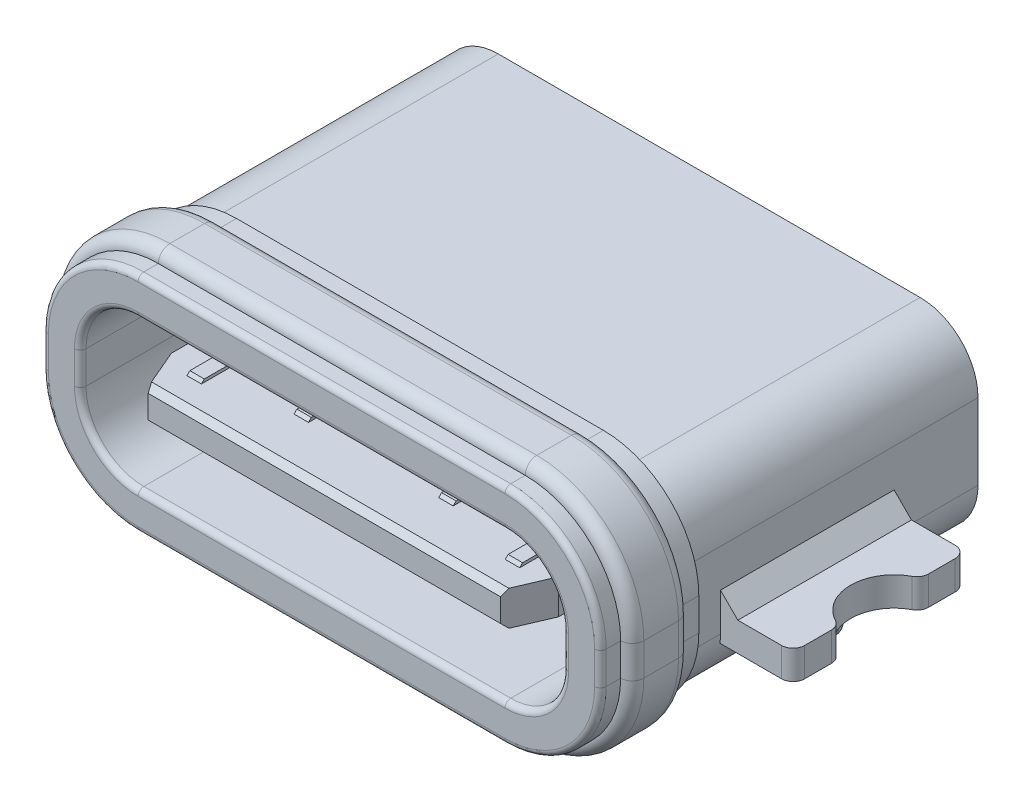
from build123d import *

# Parameters (mm, degrees)
SKETCH1_W            = 9.29
SKETCH1_H            = 3.31
BOSS_EXTRUDE1_DEPTH  = 5
FILLET1_R            = 1
SKETCH2_W            = 11.8
SKETCH2_H            = 3
BOSS_EXTRUDE2_DEPTH  = 0.5
SKETCH3_R            = 0.75
CUT_EXTRUDE1_DEPTH   = 0.5
FILLET2_R            = 0.2
FILLET15_SIZE        = 0.3
SKETCH4_W            = 10.26886331
SKETCH4_H            = 0.5
BOSS_EXTRUDE3_DEPTH  = 0.5
FILLET4_R            = 0.2
BOSS_EXTRUDE4_DEPTH  = 1.7
BOSS_EXTRUDE7_DEPTH  = 0.5
FILLET12_R           = 0.2
CUT_EXTRUDE4_DEPTH   = 4.5
BOSS_EXTRUDE8_DEPTH  = 0.3
SKETCH20_W           = 6.69
SKETCH20_H           = 1.2
BOSS_EXTRUDE11_DEPTH = 1.62
CHAMFER2_SIZE        = 0.25
FILLET13_R           = 0.4
CHAMFER1_SIZE        = 0.1
SKETCH17_W           = 0.25
SKETCH17_H           = 3.45
SKETCH17_H_2         = 3.65
SKETCH17_H_3         = 4
BOSS_EXTRUDE9_DEPTH  = 0.05
CHAMFER3_SIZE        = 0.1
MIRROR1_START        = 2.625
MIRROR1_DEPTH        = 0.25
MIRROR1_START_2      = 1.125
MIRROR1_2_DEPTH      = 0.25
MIRROR1_START_3      = 0.125
MIRROR1_3_DEPTH      = 0.25
MIRROR1_START_4      = 0.625
MIRROR1_4_DEPTH      = 0.25
MIRROR1_START_5      = 1.625
MIRROR1_5_DEPTH      = 0.25
MIRROR1_START_6      = 2.125
MIRROR1_6_DEPTH      = 0.25
MIRROR2_START        = -2.875
MIRROR2_DEPTH        = 0.25
MIRROR2_START_2      = 2.625
MIRROR2_2_DEPTH      = 0.25
MIRROR2_START_3      = -1.375
MIRROR2_3_DEPTH      = 0.25
MIRROR2_START_4      = 1.125
MIRROR2_4_DEPTH      = 0.25
MIRROR2_START_5      = -2.375
MIRROR2_5_DEPTH      = 0.25
MIRROR2_START_6      = -1.875
MIRROR2_6_DEPTH      = 0.25
MIRROR2_START_7      = -0.875
MIRROR2_7_DEPTH      = 0.25
MIRROR2_START_8      = -0.375
MIRROR2_8_DEPTH      = 0.25
MIRROR2_START_9      = 0.125
MIRROR2_9_DEPTH      = 0.25
MIRROR2_START_10     = 0.625
MIRROR2_10_DEPTH     = 0.25
MIRROR2_START_11     = 1.625
MIRROR2_11_DEPTH     = 0.25
MIRROR2_START_12     = 2.125
MIRROR2_12_DEPTH     = 0.25
FILLET14_R           = 0.1
CUT_EXTRUDE5_DEPTH   = 0.2
BOSS_EXTRUDE12_START = -3
BOSS_EXTRUDE12_DEPTH = 6
SKETCH23_W           = 0.4
SKETCH23_H           = 1.49
CUT_EXTRUDE6_DEPTH   = 1


# Read off the part's stored shape, not the designer's step: Mirror1, Mirror2, Boss-Extrude12
# Some blends are built 0.0001 mm under size
with BuildPart() as part:
    # Sketch1 → Boss-Extrude1 (new body)
    with BuildSketch(Plane.XY):
        with Locations((0, 0.8)):
            Rectangle(SKETCH1_W, SKETCH1_H)
    extrude(amount=BOSS_EXTRUDE1_DEPTH)

    # Fillet1
    fillet1_edges = [part.edges().sort_by_distance(p)[0] for p in [
        (4.645, -0.855, 2.5),
        (-4.645, -0.855, 2.5),
        (-4.645, 2.455, 2.5),
        (4.645, 2.455, 2.5),
    ]]
    fillet(fillet1_edges, radius=FILLET1_R)

    # Sketch2 → Boss-Extrude2 (add)
    with BuildSketch(Plane(origin=(0, 0, 0), x_dir=(1, 0, 0), z_dir=(0, 1, 0))):
        with Locations((0, -2.95)):
            Rectangle(SKETCH2_W, SKETCH2_H)
    extrude(amount=BOSS_EXTRUDE2_DEPTH)

    # Sketch3 → Cut-Extrude1 (cut)
    with BuildSketch(Plane(origin=(0, 0.5, 0), x_dir=(1, 0, 0), z_dir=(0, 1, 0))):
        with Locations((6.145, -2.95)):
            Circle(SKETCH3_R)
        with Locations((-6.145, -2.95)):
            Circle(SKETCH3_R)
    extrude(amount=-CUT_EXTRUDE1_DEPTH, mode=Mode.SUBTRACT)

    # Fillet2
    fillet2_edges = [part.edges().sort_by_distance(p)[0] for p in [
        (-5.9, 0.25, 4.45),
        (5.9, 0.25, 1.45),
        (-5.9, 0.25, 1.45),
        (5.9, 0.25, 4.45),
        (5.9, 0.25, 2.24114529),
        (5.9, 0.25, 3.65885471),
        (-5.9, 0.25, 2.24114529),
        (-5.9, 0.25, 3.65885471),
    ]]
    fillet(fillet2_edges, radius=FILLET2_R)

    # Fillet15
    fillet15_edges = [part.edges().sort_by_distance(p)[0] for p in [
        (-4.645, 0.5, 2.95),
        (4.645, 0.5, 2.95),
    ]]
    chamfer(fillet15_edges, length=FILLET15_SIZE)

    # Sketch4 → Boss-Extrude3 (add)
    with BuildSketch(Plane.XZ):
        with Locations((0, 2.95)):
            Rectangle(SKETCH4_W, SKETCH4_H)
    extrude(amount=BOSS_EXTRUDE3_DEPTH)

    # Fillet4
    fillet4_edges = [part.edges().sort_by_distance(p)[0] for p in [
        (4.771807112, -0.5, 2.7),
        (5.134431655, -0.5, 2.95),
        (4.771807112, -0.5, 3.2),
        (5.134431655, -0.25, 3.2),
        (5.134431655, -0.25, 2.7),
        (-5.134431655, -0.25, 3.2),
        (-5.134431655, -0.25, 2.7),
        (-4.771807112, -0.5, 3.2),
        (-5.134431655, -0.5, 2.95),
        (-4.771807112, -0.5, 2.7),
    ]]
    fillet(fillet4_edges, radius=FILLET4_R)

    # Sketch5 → Boss-Extrude4 (add)
    with BuildSketch(Plane.XY.offset(5)):
        with BuildLine():
            Line((-4.82, 1.08), (-4.82, 0.52))
            ThreePointArc((-4.82, 0.52), (-4.336726189, -0.646726189), (-3.17, -1.13))
            Line((-3.17, -1.13), (3.17, -1.13))
            ThreePointArc((3.17, -1.13), (4.336726189, -0.646726189), (4.82, 0.52))
            Line((4.82, 0.52), (4.82, 1.08))
            ThreePointArc((4.82, 1.08), (4.336726189, 2.246726189), (3.17, 2.73))
            Line((3.17, 2.73), (-3.17, 2.73))
            ThreePointArc((-3.17, 2.73), (-4.336726189, 2.246726189), (-4.82, 1.08))
        make_face()
    extrude(amount=BOSS_EXTRUDE4_DEPTH)

    # Sketch11 → Boss-Extrude7 (add, symmetric)
    with BuildSketch(Plane.XY.offset(5.85)):
        with BuildLine():
            Line((-5.02, 1.08), (-5.02, 0.52))
            ThreePointArc((-5.02, 0.52), (-4.478147545, -0.788147545), (-3.17, -1.33))
            Line((-3.17, -1.33), (3.17, -1.33))
            ThreePointArc((3.17, -1.33), (4.478147545, -0.788147545), (5.02, 0.52))
            Line((5.02, 0.52), (5.02, 1.08))
            ThreePointArc((5.02, 1.08), (4.478147545, 2.388147545), (3.17, 2.93))
            Line((3.17, 2.93), (-3.17, 2.93))
            ThreePointArc((-3.17, 2.93), (-4.478147545, 2.388147545), (-5.02, 1.08))
        make_face()
    extrude(amount=BOSS_EXTRUDE7_DEPTH, both=True)

    # Fillet12
    fillet12_edges = [part.edges().sort_by_distance(p)[0] for p in [
        (-4.478147545, 2.388147545, 6.35),
        (-5.02, 0.8, 6.35),
        (-4.478147545, -0.788147545, 6.35),
        (0, -1.33, 6.35),
        (4.478147545, -0.788147545, 6.35),
        (5.02, 0.8, 6.35),
        (4.478147545, 2.388147545, 6.35),
        (0, 2.93, 6.35),
        (-4.478147545, 2.388147545, 5.35),
        (-5.02, 0.8, 5.35),
        (-4.478147545, -0.788147545, 5.35),
        (0, -1.33, 5.35),
        (4.478147545, -0.788147545, 5.35),
        (5.02, 0.8, 5.35),
        (4.478147545, 2.388147545, 5.35),
        (0, 2.93, 5.35),
    ]]
    fillet(fillet12_edges, radius=FILLET12_R - 0.0001)  # a hair under: the kernel refuses the full size

    # Sketch14 → Cut-Extrude4 (cut)
    with BuildSketch(Plane.XY.offset(6.7)):
        with BuildLine():
            Line((-3.17, 2.08), (3.17, 2.08))
            ThreePointArc((3.17, 2.08), (3.877106781, 1.787106781), (4.17, 1.08))
            Line((4.17, 1.08), (4.17, 0.52))
            ThreePointArc((4.17, 0.52), (3.877106781, -0.187106781), (3.17, -0.48))
            Line((3.17, -0.48), (-3.17, -0.48))
            ThreePointArc((-3.17, -0.48), (-3.877106781, -0.187106781), (-4.17, 0.52))
            Line((-4.17, 0.52), (-4.17, 1.08))
            ThreePointArc((-4.17, 1.08), (-3.877106781, 1.787106781), (-3.17, 2.08))
        make_face()
    extrude(amount=-CUT_EXTRUDE4_DEPTH, mode=Mode.SUBTRACT)

    # Sketch16 → Boss-Extrude8 (add, symmetric)
    with BuildSketch(Plane(origin=(0, 0.8, 0), x_dir=(1, 0, 0), z_dir=(0, 1, 0))):
        with BuildLine():
            Line((-3.345, -2.2), (-3.345, -3.9))
            ThreePointArc((-3.345, -3.9), (-3.165871215, -4.002154822), (-3.095, -4.195803989))
            Line((-3.095, -4.195803989), (-3.095, -5.104196011))
            ThreePointArc((-3.095, -5.104196011), (-3.165871215, -5.297845178), (-3.345, -5.4))
            Line((-3.345, -5.4), (-3.345, -5.95))
            Line((-3.345, -5.95), (-3.045, -6.65))
            Line((-3.045, -6.65), (3.045, -6.65))
            Line((3.045, -6.65), (3.345, -5.95))
            Line((3.345, -5.95), (3.345, -5.4))
            ThreePointArc((3.345, -5.4), (3.165871215, -5.297845178), (3.095, -5.104196011))
            Line((3.095, -5.104196011), (3.095, -4.195803989))
            ThreePointArc((3.095, -4.195803989), (3.165871215, -4.002154822), (3.345, -3.9))
            Line((3.345, -3.9), (3.345, -2.2))
            Line((3.345, -2.2), (-3.345, -2.2))
        make_face()
    extrude(amount=BOSS_EXTRUDE8_DEPTH, both=True)

    # Sketch20 → Boss-Extrude11 (add)
    with BuildSketch(Plane.XY.offset(2.2)):
        with Locations((0, 0.8)):
            Rectangle(SKETCH20_W, SKETCH20_H)
    extrude(amount=BOSS_EXTRUDE11_DEPTH)

    # Chamfer2
    chamfer2_edges = [part.edges().sort_by_distance(p)[0] for p in [
        (0, 0.2, 3.82),
        (0, 1.4, 3.82),
    ]]
    chamfer(chamfer2_edges, length=CHAMFER2_SIZE)

    # Fillet13
    fillet13_edges = [part.edges().sort_by_distance(p)[0] for p in [
        (3.345, 0.2, 2.885),
        (3.345, 1.4, 2.885),
        (-3.345, 0.2, 2.885),
        (-3.345, 1.4, 2.885),
    ]]
    fillet(fillet13_edges, radius=FILLET13_R)

    # Chamfer1
    chamfer1_edges = [part.edges().sort_by_distance(p)[0] for p in [
        (0, 0.5, 6.65),
        (0, 1.1, 6.65),
    ]]
    chamfer(chamfer1_edges, length=CHAMFER1_SIZE)

    # Sketch17 → Boss-Extrude9 (add, symmetric)
    with BuildSketch(Plane(origin=(0, 1.1, 0), x_dir=(1, 0, 0), z_dir=(0, 1, 0))):
        with Locations((-0.25, -3.925)):
            Rectangle(SKETCH17_W, SKETCH17_H)
        with Locations((-0.75, -3.925)):
            Rectangle(SKETCH17_W, SKETCH17_H)
        with Locations((-1.25, -4.025)):
            Rectangle(SKETCH17_W, SKETCH17_H_2)
        with Locations((-1.75, -3.925)):
            Rectangle(SKETCH17_W, SKETCH17_H)
        with Locations((-2.25, -3.925)):
            Rectangle(SKETCH17_W, SKETCH17_H)
        with Locations((-2.75, -4.2)):
            Rectangle(SKETCH17_W, SKETCH17_H_3)
    extrude(amount=BOSS_EXTRUDE9_DEPTH, both=True)

    # Chamfer3
    # the kernel refuses this chamfer: 0.1 mm, written as the material it takes off along each edge
    with BuildSketch(Plane(origin=(-0.367831701, 1.15, 5.65), x_dir=(0, -0.9996219169112966, 0.027495876610587302), z_dir=(-1, 0, 0))) as chamfer3_piece_1_section:
        Polygon((CHAMFER3_SIZE * 0.999621916911, -CHAMFER3_SIZE * 0.0274958766106), (-CHAMFER3_SIZE * 0.0274958766106, -CHAMFER3_SIZE * 0.999621916911), (0, 0), align=None)
    chamfer3_piece_1 = extrude(amount=0.507168299, mode=Mode.PRIVATE)
    chamfer3_piece_1 = split(chamfer3_piece_1, bisect_by=Plane(origin=(-0.371415851, 1.1, 5.611111111), z_dir=(0, 1, 0)), keep=Keep.TOP, mode=Mode.PRIVATE)
    add(chamfer3_piece_1, mode=Mode.SUBTRACT)
    with BuildSketch(Plane(origin=(-0.867831701, 1.15, 5.85), x_dir=(0, -0.9996219169112966, 0.027495876610587302), z_dir=(-1, 0, 0))) as chamfer3_piece_2_section:
        Polygon((CHAMFER3_SIZE * 0.999621916911, -CHAMFER3_SIZE * 0.0274958766106), (-CHAMFER3_SIZE * 0.0274958766106, -CHAMFER3_SIZE * 0.999621916911), (0, 0), align=None)
    chamfer3_piece_2 = extrude(amount=0.764336598, mode=Mode.PRIVATE)
    chamfer3_piece_2 = split(chamfer3_piece_2, bisect_by=Plane(origin=(-1.25, 1.1, 5.811111111), z_dir=(0, 1, 0)), keep=Keep.TOP, mode=Mode.PRIVATE)
    add(chamfer3_piece_2, mode=Mode.SUBTRACT)
    with BuildSketch(Plane(origin=(-1.367831701, 1.15, 5.65), x_dir=(0, -0.9996219169112966, 0.027495876610587302), z_dir=(-1, 0, 0))) as chamfer3_piece_3_section:
        Polygon((CHAMFER3_SIZE * 0.999621916911, -CHAMFER3_SIZE * 0.0274958766106), (-CHAMFER3_SIZE * 0.0274958766106, -CHAMFER3_SIZE * 0.999621916911), (0, 0), align=None)
    chamfer3_piece_3 = extrude(amount=0.764336598, mode=Mode.PRIVATE)
    chamfer3_piece_3 = split(chamfer3_piece_3, bisect_by=Plane(origin=(-1.75, 1.1, 5.611111111), z_dir=(0, 1, 0)), keep=Keep.TOP, mode=Mode.PRIVATE)
    chamfer3_piece_3 = split(chamfer3_piece_3, bisect_by=Plane(origin=(-1.375, 1.127777778, 5.611111111), z_dir=(-1, 0, 0)), keep=Keep.TOP, mode=Mode.PRIVATE)
    add(chamfer3_piece_3, mode=Mode.SUBTRACT)
    with BuildSketch(Plane(origin=(-1.867831701, 1.15, 5.65), x_dir=(0, -0.9996219169112966, 0.027495876610587302), z_dir=(-1, 0, 0))) as chamfer3_piece_4_section:
        Polygon((CHAMFER3_SIZE * 0.999621916911, -CHAMFER3_SIZE * 0.0274958766106), (-CHAMFER3_SIZE * 0.0274958766106, -CHAMFER3_SIZE * 0.999621916911), (0, 0), align=None)
    chamfer3_piece_4 = extrude(amount=0.507168299, mode=Mode.PRIVATE)
    chamfer3_piece_4 = split(chamfer3_piece_4, bisect_by=Plane(origin=(-1.871415851, 1.1, 5.611111111), z_dir=(0, 1, 0)), keep=Keep.TOP, mode=Mode.PRIVATE)
    add(chamfer3_piece_4, mode=Mode.SUBTRACT)
    with BuildSketch(Plane(origin=(-2.367831701, 1.15, 6.2), x_dir=(0, -0.9996219169112966, 0.027495876610587302), z_dir=(-1, 0, 0))) as chamfer3_piece_5_section:
        Polygon((CHAMFER3_SIZE * 0.999621916911, -CHAMFER3_SIZE * 0.0274958766106), (-CHAMFER3_SIZE * 0.0274958766106, -CHAMFER3_SIZE * 0.999621916911), (0, 0), align=None)
    chamfer3_piece_5 = extrude(amount=0.764336598, mode=Mode.PRIVATE)
    chamfer3_piece_5 = split(chamfer3_piece_5, bisect_by=Plane(origin=(-2.75, 1.1, 6.161111111), z_dir=(0, 1, 0)), keep=Keep.TOP, mode=Mode.PRIVATE)
    add(chamfer3_piece_5, mode=Mode.SUBTRACT)
    with BuildSketch(Plane(origin=(-0.632168299, 1.15, 5.65), x_dir=(0, -0.9996219169112966, 0.027495876610587302), z_dir=(1, 0, 0))) as chamfer3_piece_6_section:
        Polygon((CHAMFER3_SIZE * 0.999621916911, CHAMFER3_SIZE * 0.0274958766106), (-CHAMFER3_SIZE * 0.0274958766106, CHAMFER3_SIZE * 0.999621916911), (0, 0), align=None)
    chamfer3_piece_6 = extrude(amount=0.764336598, mode=Mode.PRIVATE)
    chamfer3_piece_6 = split(chamfer3_piece_6, bisect_by=Plane(origin=(-0.628584149, 1.1, 5.611111111), z_dir=(0, 1, 0)), keep=Keep.TOP, mode=Mode.PRIVATE)
    add(chamfer3_piece_6, mode=Mode.SUBTRACT)

    # Mirror1 outline → Mirror1 (add)
    with BuildSketch(Plane.YZ.offset(MIRROR1_START)):
        Polygon((1.1, 3.82), (1.15, 3.82), (1.15, 6.1), (1.1, 6.15), align=None)
    extrude(amount=MIRROR1_DEPTH)

    # Mirror1 2 outline → Mirror1 2 (add)
    with BuildSketch(Plane.YZ.offset(MIRROR1_START_2)):
        Polygon((1.1, 5.8), (1.1, 3.82), (1.15, 3.82), (1.15, 5.75), align=None)
    extrude(amount=MIRROR1_2_DEPTH)

    # Mirror1 3 outline → Mirror1 3 (add)
    with BuildSketch(Plane.YZ.offset(MIRROR1_START_3)):
        Polygon((1.15, 3.82), (1.15, 5.55), (1.1, 5.6), (1.1, 3.82), align=None)
    extrude(amount=MIRROR1_3_DEPTH)

    # Mirror1 4 outline → Mirror1 4 (add)
    with BuildSketch(Plane.YZ.offset(MIRROR1_START_4)):
        Polygon((1.15, 3.82), (1.15, 5.55), (1.1, 5.6), (1.1, 3.82), align=None)
    extrude(amount=MIRROR1_4_DEPTH)

    # Mirror1 5 outline → Mirror1 5 (add)
    with BuildSketch(Plane.YZ.offset(MIRROR1_START_5)):
        Polygon((1.15, 3.82), (1.15, 5.55), (1.1, 5.6), (1.1, 3.82), align=None)
    extrude(amount=MIRROR1_5_DEPTH)

    # Mirror1 6 outline → Mirror1 6 (add)
    with BuildSketch(Plane.YZ.offset(MIRROR1_START_6)):
        Polygon((1.15, 3.82), (1.15, 5.55), (1.1, 5.6), (1.1, 3.82), align=None)
    extrude(amount=MIRROR1_6_DEPTH)

    # Mirror2 outline → Mirror2 (add)
    with BuildSketch(Plane.YZ.offset(MIRROR2_START)):
        Polygon((0.45, 3.82), (0.5, 3.82), (0.5, 6.15), (0.45, 6.1), align=None)
    extrude(amount=MIRROR2_DEPTH)

    # Mirror2 2 outline → Mirror2 2 (add)
    with BuildSketch(Plane.YZ.offset(MIRROR2_START_2)):
        Polygon((0.45, 3.82), (0.5, 3.82), (0.5, 6.15), (0.45, 6.1), align=None)
    extrude(amount=MIRROR2_2_DEPTH)

    # Mirror2 3 outline → Mirror2 3 (add)
    with BuildSketch(Plane.YZ.offset(MIRROR2_START_3)):
        Polygon((0.45, 3.82), (0.5, 3.82), (0.5, 5.8), (0.45, 5.75), align=None)
    extrude(amount=MIRROR2_3_DEPTH)

    # Mirror2 4 outline → Mirror2 4 (add)
    with BuildSketch(Plane.YZ.offset(MIRROR2_START_4)):
        Polygon((0.45, 3.82), (0.5, 3.82), (0.5, 5.8), (0.45, 5.75), align=None)
    extrude(amount=MIRROR2_4_DEPTH)

    # Mirror2 5 outline → Mirror2 5 (add)
    with BuildSketch(Plane.YZ.offset(MIRROR2_START_5)):
        Polygon((0.45, 5.55), (0.45, 3.82), (0.5, 3.82), (0.5, 5.6), align=None)
    extrude(amount=MIRROR2_5_DEPTH)

    # Mirror2 6 outline → Mirror2 6 (add)
    with BuildSketch(Plane.YZ.offset(MIRROR2_START_6)):
        Polygon((0.45, 5.55), (0.45, 3.82), (0.5, 3.82), (0.5, 5.6), align=None)
    extrude(amount=MIRROR2_6_DEPTH)

    # Mirror2 7 outline → Mirror2 7 (add)
    with BuildSketch(Plane.YZ.offset(MIRROR2_START_7)):
        Polygon((0.45, 5.55), (0.45, 3.82), (0.5, 3.82), (0.5, 5.6), align=None)
    extrude(amount=MIRROR2_7_DEPTH)

    # Mirror2 8 outline → Mirror2 8 (add)
    with BuildSketch(Plane.YZ.offset(MIRROR2_START_8)):
        Polygon((0.45, 5.55), (0.45, 3.82), (0.5, 3.82), (0.5, 5.6), align=None)
    extrude(amount=MIRROR2_8_DEPTH)

    # Mirror2 9 outline → Mirror2 9 (add)
    with BuildSketch(Plane.YZ.offset(MIRROR2_START_9)):
        Polygon((0.45, 5.55), (0.45, 3.82), (0.5, 3.82), (0.5, 5.6), align=None)
    extrude(amount=MIRROR2_9_DEPTH)

    # Mirror2 10 outline → Mirror2 10 (add)
    with BuildSketch(Plane.YZ.offset(MIRROR2_START_10)):
        Polygon((0.45, 5.55), (0.45, 3.82), (0.5, 3.82), (0.5, 5.6), align=None)
    extrude(amount=MIRROR2_10_DEPTH)

    # Mirror2 11 outline → Mirror2 11 (add)
    with BuildSketch(Plane.YZ.offset(MIRROR2_START_11)):
        Polygon((0.45, 5.55), (0.45, 3.82), (0.5, 3.82), (0.5, 5.6), align=None)
    extrude(amount=MIRROR2_11_DEPTH)

    # Mirror2 12 outline → Mirror2 12 (add)
    with BuildSketch(Plane.YZ.offset(MIRROR2_START_12)):
        Polygon((0.45, 5.55), (0.45, 3.82), (0.5, 3.82), (0.5, 5.6), align=None)
    extrude(amount=MIRROR2_12_DEPTH)

    # Fillet14
    fillet14_edges = [part.edges().sort_by_distance(p)[0] for p in [
        (-4.336726189, 2.246726189, 6.7),
        (-4.82, 0.8, 6.7),
        (-4.336726189, -0.646726189, 6.7),
        (0, -1.13, 6.7),
        (4.336726189, -0.646726189, 6.7),
        (4.82, 0.8, 6.7),
        (4.336726189, 2.246726189, 6.7),
        (0, 2.73, 6.7),
        (-3.877106781, 1.787106781, 6.7),
        (-4.17, 0.8, 6.7),
        (-3.877106781, -0.187106781, 6.7),
        (0, -0.48, 6.7),
        (3.877106781, -0.187106781, 6.7),
        (4.17, 0.8, 6.7),
        (3.877106781, 1.787106781, 6.7),
        (0, 2.08, 6.7),
    ]]
    fillet(fillet14_edges, radius=FILLET14_R)

    # Sketch21 → Cut-Extrude5 (cut)
    with BuildSketch(Plane(origin=(0, 0, 0), x_dir=(-1, 0, 0), z_dir=(0, 0, -1))):
        with BuildLine():
            Line((-4.445, 1.455), (-4.445, 0.145))
            ThreePointArc((-4.445, 0.145), (-4.210685425, -0.420685425), (-3.645, -0.655))
            Line((-3.645, -0.655), (3.645, -0.655))
            ThreePointArc((3.645, -0.655), (4.210685425, -0.420685425), (4.445, 0.145))
            Line((4.445, 0.145), (4.445, 1.455))
            ThreePointArc((4.445, 1.455), (4.210685425, 2.020685425), (3.645, 2.255))
            Line((3.645, 2.255), (-3.645, 2.255))
            ThreePointArc((-3.645, 2.255), (-4.210685425, 2.020685425), (-4.445, 1.455))
        make_face()
    extrude(amount=-CUT_EXTRUDE5_DEPTH, mode=Mode.SUBTRACT)

    # Boss-Extrude12 outline → Boss-Extrude12 (add)
    with BuildSketch(Plane(origin=(0, 0, 0), x_dir=(0, 0, -1), z_dir=(1, 0, 0)).offset(BOSS_EXTRUDE12_START)):
        with BuildLine():
            Line((-0.2, 0.85), (-0.2, 0.75))
            add(Edge.make_bspline(
                [(-0.2, 0.75), (0.545, 0.75), (0.396, 0.75), (0.396, 0), (0.247, 0), (1.141, 0)],
                knots=[0, 0, 0, 0, 0, 0, 1, 1, 1, 1, 1, 1], degree=5))
            Line((1.141, 0), (1.29, 0))
            Line((1.29, 0), (1.29, 0.1))
            Line((1.29, 0.1), (1.141, 0.1))
            add(Edge.make_bspline(
                [(-0.2, 0.85), (-0.132273383, 0.85), (0.015913944, 0.849664624), (0.210358702, 0.838045777), (0.405764932, 0.764298618), (0.487476476, 0.562663736), (0.497552571, 0.381761351), (0.523312336, 0.219598978), (0.557336147, 0.15658615), (0.671819977, 0.112662749), (0.884169952, 0.100085498), (1.061301134, 0.1), (1.141, 0.1)],
                knots=[0, 0, 0, 0, 0.0625, 0.125, 0.25, 0.375, 0.5, 0.625, 0.75, 0.875, 0.9375, 1, 1, 1, 1], degree=3))
        make_face()
    extrude(amount=BOSS_EXTRUDE12_DEPTH)

    # Sketch23 → Cut-Extrude6 (cut, symmetric)
    with BuildSketch(Plane(origin=(0, 0.8, 0), x_dir=(1, 0, 0), z_dir=(0, 1, 0))):
        with Locations((-2.4, 0.545)):
            Rectangle(SKETCH23_W, SKETCH23_H)
        with Locations((-1.6, 0.545)):
            Rectangle(SKETCH23_W, SKETCH23_H)
        with Locations((-0.8, 0.545)):
            Rectangle(SKETCH23_W, SKETCH23_H)
        with Locations((0, 0.545)):
            Rectangle(SKETCH23_W, SKETCH23_H)
        with Locations((0.8, 0.545)):
            Rectangle(SKETCH23_W, SKETCH23_H)
        with Locations((1.6, 0.545)):
            Rectangle(SKETCH23_W, SKETCH23_H)
        with Locations((2.4, 0.545)):
            Rectangle(SKETCH23_W, SKETCH23_H)
    extrude(amount=CUT_EXTRUDE6_DEPTH, both=True, mode=Mode.SUBTRACT)


solid = part.part
